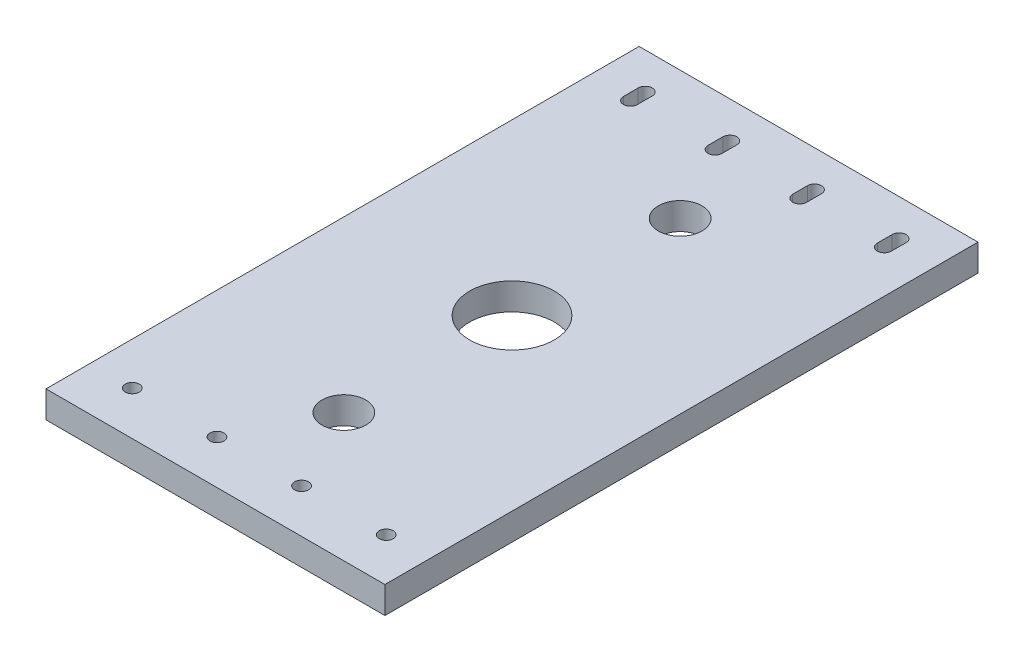
from build123d import *

# Parameters (mm, degrees)
SKETCH1_W           = 80
SKETCH1_H           = 140
BOSS_EXTRUDE1_DEPTH = 6.35
SKETCH2_R           = 1.65
SKETCH2_R_2         = 10
SKETCH2_R_3         = 5.159375
CUT_EXTRUDE1_DEPTH  = 162.37014129


with BuildPart() as part:
    # Sketch1 → Boss-Extrude1 (new body)
    with BuildSketch(Plane(origin=(0, 0, 0), x_dir=(1, 0, 0), z_dir=(0, 1, 0))):
        with Locations((40, 70)):
            Rectangle(SKETCH1_W, SKETCH1_H)
    extrude(amount=BOSS_EXTRUDE1_DEPTH)

    # Sketch2 → Cut-Extrude1 (cut, through all)
    with BuildSketch(Plane(origin=(0, 6.35, 0), x_dir=(1, 0, 0), z_dir=(0, 1, 0))):
        with Locations((10.03, 10.335)):
            Circle(SKETCH2_R)
        with Locations((30.01, 10.335)):
            Circle(SKETCH2_R)
        with Locations((49.99, 10.335)):
            Circle(SKETCH2_R)
        with Locations((69.97, 10.335)):
            Circle(SKETCH2_R)
        with Locations((40, 70)):
            Circle(SKETCH2_R_2)
        with Locations((40, 109.6875)):
            Circle(SKETCH2_R_3)
        with Locations((40, 30.3125)):
            Circle(SKETCH2_R_3)
        with BuildLine():
            Line((28.36, 127.915), (28.36, 131.415))
            ThreePointArc((28.36, 131.415), (30.01, 133.065), (31.66, 131.415))
            Line((31.66, 131.415), (31.66, 127.915))
            ThreePointArc((31.66, 127.915), (30.01, 126.265), (28.36, 127.915))
        make_face()
        with BuildLine():
            Line((8.38, 127.915), (8.38, 131.415))
            ThreePointArc((8.38, 131.415), (10.03, 133.065), (11.68, 131.415))
            Line((11.68, 131.415), (11.68, 127.915))
            ThreePointArc((11.68, 127.915), (10.03, 126.265), (8.38, 127.915))
        make_face()
        with BuildLine():
            Line((51.64, 127.915), (51.64, 131.415))
            ThreePointArc((51.64, 131.415), (49.99, 133.065), (48.34, 131.415))
            Line((48.34, 131.415), (48.34, 127.915))
            ThreePointArc((48.34, 127.915), (49.99, 126.265), (51.64, 127.915))
        make_face()
        with BuildLine():
            Line((71.62, 127.915), (71.62, 131.415))
            ThreePointArc((71.62, 131.415), (69.97, 133.065), (68.32, 131.415))
            Line((68.32, 131.415), (68.32, 127.915))
            ThreePointArc((68.32, 127.915), (69.97, 126.265), (71.62, 127.915))
        make_face()
    extrude(amount=-CUT_EXTRUDE1_DEPTH, mode=Mode.SUBTRACT)


solid = part.part
